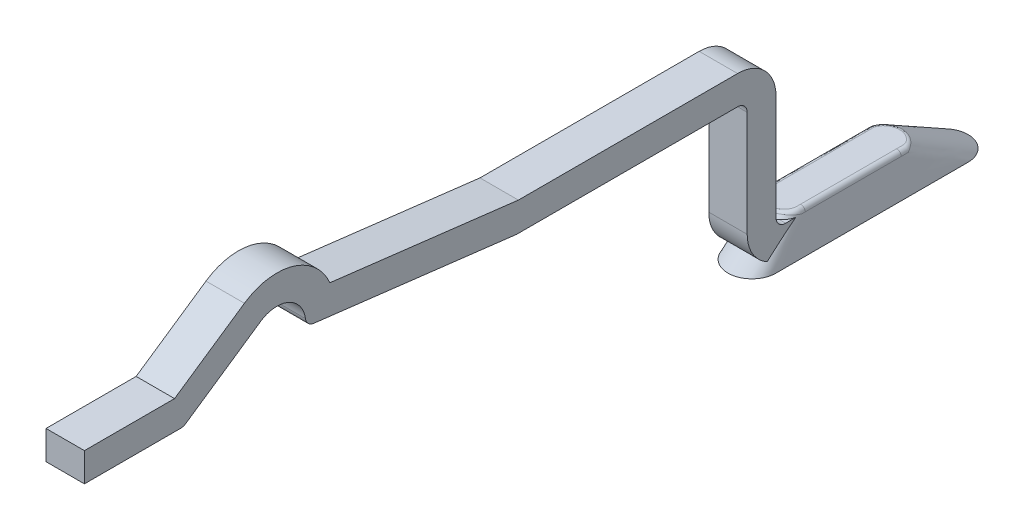
from build123d import *

# Parameters (mm, degrees)
EXTRUDE_THIN1_DEPTH = 0.2
FILLET2_R           = 0.05


with BuildPart() as part:
    # Sketch1 → Extrude-Thin1 (new, symmetric)
    with BuildSketch(Plane(origin=(0, 0, 0), x_dir=(0, 0, -1), z_dir=(1, 0, 0))):
        with BuildLine():
            Line((1.5, 0), (0.4, 0))
            ThreePointArc((0.4, 0), (0.117157288, 0.117157288), (0, 0.4))
            Line((0, 0.4), (0, 1.5))
            ThreePointArc((0, 1.5), (-0.029289322, 1.570710678), (-0.1, 1.6))
            Line((-0.1, 1.6), (-2.4, 1.6))
            Line((-2.4, 1.6), (-4.511931163, 1.853790806))
            ThreePointArc((-4.511931163, 1.853790806), (-4.570232229, 1.88189058), (-4.599115742, 1.939807369))
            ThreePointArc((-4.599115742, 1.939807369), (-4.774219375, 2.173964421), (-5.065441937, 2.147883256))
            Line((-5.065441937, 2.147883256), (-5.843673678, 1.617372248))
            ThreePointArc((-5.843673678, 1.617372248), (-5.870527769, 1.604441706), (-5.9, 1.6))
            Line((-5.9, 1.6), (-6.9, 1.6))
            Line((-6.9, 1.6), (-6.9, 1.9))
            Line((-6.9, 1.9), (-5.961684297, 1.9))
            Line((-5.961684297, 1.9), (-5.234420904, 2.395766512))
            ThreePointArc((-5.234420904, 2.395766512), (-4.728210685, 2.475926357), (-4.344765926, 2.135860917))
            Line((-4.344765926, 2.135860917), (-2.382039107, 1.9))
            Line((-2.382039107, 1.9), (-0.1, 1.9))
            ThreePointArc((-0.1, 1.9), (0.182842712, 1.782842712), (0.3, 1.5))
            Line((0.3, 1.5), (0.3, 0.4))
            ThreePointArc((0.3, 0.4), (0.329289322, 0.329289322), (0.4, 0.3))
            Line((0.4, 0.3), (1.5, 0.3))
            Line((1.5, 0.3), (1.5, 0))
        make_face()
    extrude(amount=EXTRUDE_THIN1_DEPTH, both=True)

    # Sketch3 → Loft1 section 0
    with BuildSketch(Plane(origin=(0, 0.35, 0), x_dir=(1, 0, 0), z_dir=(0, 1, 0))):
        with BuildLine():
            Line((0.2, 1.6), (0.2, 0.6))
            ThreePointArc((0.2, 0.6), (0, 0.4), (-0.2, 0.6))
            Line((-0.2, 0.6), (-0.2, 1.6))
            ThreePointArc((-0.2, 1.6), (0, 1.8), (0.2, 1.6))
        make_face()
    # Sketch2 → Loft1 section 1
    with BuildSketch(Plane(origin=(0, -0.05, 0), x_dir=(1, 0, 0), z_dir=(0, 1, 0))):
        with BuildLine():
            Line((0.25, 2.25), (0.25, 0.25))
            ThreePointArc((0.25, 0.25), (0, 0), (-0.25, 0.25))
            Line((-0.25, 0.25), (-0.25, 2.25))
            ThreePointArc((-0.25, 2.25), (0, 2.5), (0.25, 2.25))
        make_face()
    loft()

    # Fillet2
    fillet2_edges = [part.edges().sort_by_distance(p)[0] for p in [
        (0, 0.35, -1.8),
        (-0.2, 0.35, -1.1),
        (0, 0.35, -0.4),
        (0.2, 0.35, -1.1),
    ]]
    fillet(fillet2_edges, radius=FILLET2_R)


solid = part.part
